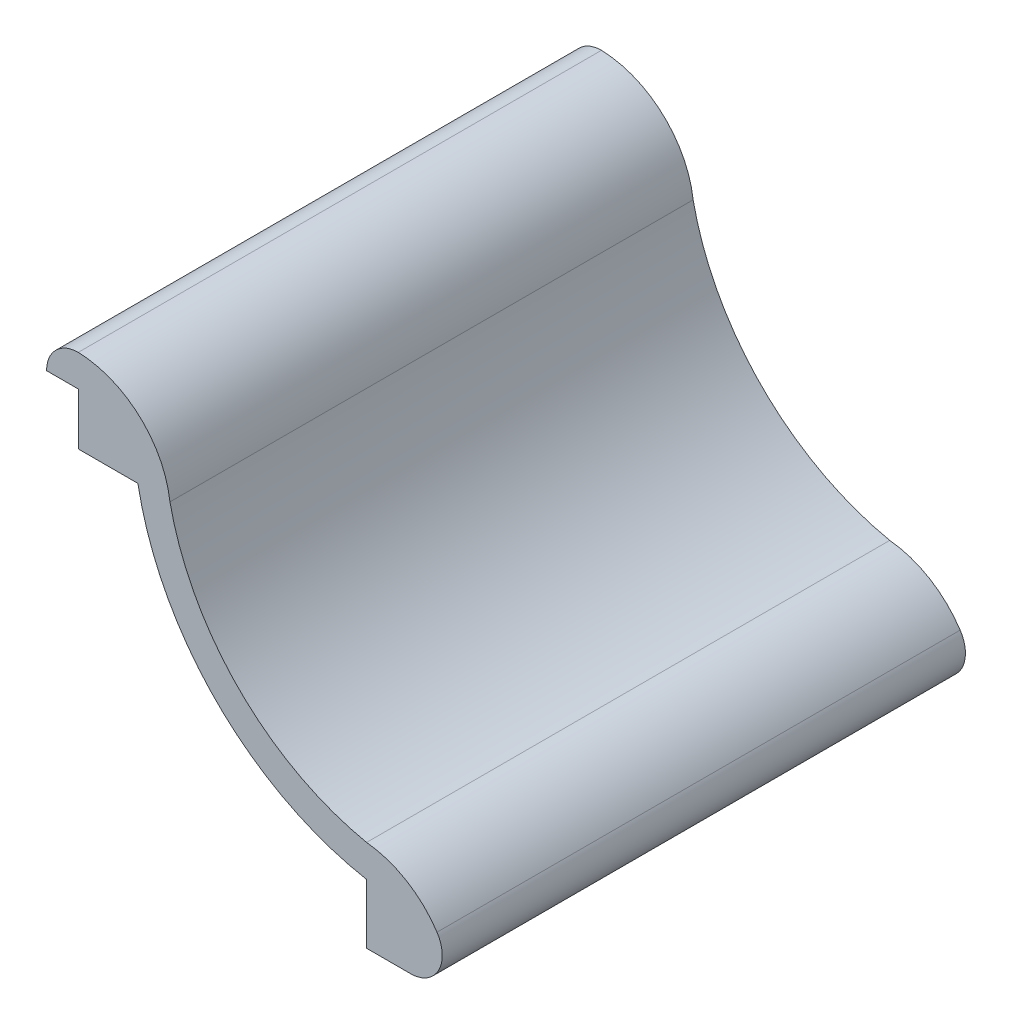
from build123d import *

# Parameters (mm, degrees)
BOSS_EXTRUDE1_DEPTH = 104.775
BOSS_EXTRUDE2_DEPTH = 92.5957
BOSS_EXTRUDE3_START = -5.8293
BOSS_EXTRUDE3_DEPTH = 5.8293
BOSS_EXTRUDE4_DEPTH = 6.35
SKETCH5_W           = 7.787485422
SKETCH5_H           = 19.833751934
SKETCH5_W_2         = 22.754058967
SKETCH5_H_2         = 3.407024872
CUT_EXTRUDE1_DEPTH  = 227.312030137
SKETCH9_W           = 103.741840618
SKETCH9_H           = 106.576317138
CUT_EXTRUDE4_DEPTH  = 104.775
SKETCH10_W          = 104.775
SKETCH10_H          = 6.354337814
BOSS_EXTRUDE6_DEPTH = 6.35
FILLET2_R           = 6.35


with BuildPart() as part:
    # Sketch1 → Boss-Extrude1 (new, symmetric)
    with BuildSketch(Plane.XY):
        with BuildLine():
            Line((-58.2422, 56.2102), (-58.2422, 62.5602))
            ThreePointArc((-58.2422, 62.5602), (-45.640852469, 57.743322347), (-39.3748699, 45.7962))
            ThreePointArc((-39.3748699, 45.7962), (-25.556268964, 20.239931036), (0, 6.4213301))
            ThreePointArc((0, 6.4213301), (12.247457496, 0.293755183), (17.272, -12.446))
            Line((17.272, -12.446), (10.922, -12.446))
            ThreePointArc((10.922, -12.446), (7.760938146, -4.204686933), (0, 0))
            ThreePointArc((0, 0), (-30.011530905, 15.784669095), (-45.7962, 45.7962))
            ThreePointArc((-45.7962, 45.7962), (-50.144819563, 53.243313205), (-58.2422, 56.2102))
        make_face()
    extrude(amount=BOSS_EXTRUDE1_DEPTH, both=True)


with BuildPart() as boss_extrude2_tool:
    # Sketch2 → Boss-Extrude2 (new, symmetric)
    with BuildSketch(Plane.XY):
        with BuildLine():
            Line((-58.2422, 56.2102), (-58.2422, 45.796198296))
            Line((-58.2422, 45.796198296), (-45.796199685, 45.796198296))
            ThreePointArc((-45.796199685, 45.796198296), (-50.144818899, 53.243312648), (-58.2422, 56.2102))
        make_face()
        with BuildLine():
            Line((0, 0), (0, -12.446))
            Line((0, -12.446), (10.922, -12.446))
            ThreePointArc((10.922, -12.446), (7.760938146, -4.204686933), (0, 0))
        make_face()
    extrude(amount=BOSS_EXTRUDE2_DEPTH, both=True)


with BuildPart() as part_1:
    add(part.part)


with BuildPart() as part_2:
    # Boss-Extrude2: joined with boss_extrude2_tool
    add(part_1.part.fuse(boss_extrude2_tool.part, tol=0.00001))

    # Sketch3 → Boss-Extrude3 (add)
    with BuildSketch(Plane(origin=(0, 0, -104.775), x_dir=(-1, 0, 0), z_dir=(0, 0, -1)).offset(BOSS_EXTRUDE3_START)):
        with BuildLine():
            Line((58.2422, 56.2102), (58.2422, 45.796198296))
            Line((58.2422, 45.796198296), (45.7962, 45.7962))
            ThreePointArc((45.7962, 45.7962), (50.144819563, 53.243313205), (58.2422, 56.2102))
        make_face()
        with BuildLine():
            Line((0, 0), (0, -12.446))
            Line((0, -12.446), (-10.922, -12.446))
            ThreePointArc((-10.922, -12.446), (-7.760938146, -4.204686933), (0, 0))
        make_face()
    extrude(amount=BOSS_EXTRUDE3_DEPTH)

    # Sketch4 → Boss-Extrude4 (add)
    with BuildSketch(Plane.XY.offset(104.775)):
        with BuildLine():
            Line((-58.2422, 56.2102), (-58.2422, 45.796198296))
            Line((-58.2422, 45.796198296), (-45.7962, 45.7962))
            ThreePointArc((-45.7962, 45.7962), (-50.144819563, 53.243313205), (-58.2422, 56.2102))
        make_face()
        with BuildLine():
            Line((0, 0), (0, -12.446))
            Line((0, -12.446), (10.922, -12.446))
            ThreePointArc((10.922, -12.446), (7.760938146, -4.204686933), (0, 0))
        make_face()
    extrude(amount=-BOSS_EXTRUDE4_DEPTH)

    # Sketch5 → Cut-Extrude1 (cut, through all)
    with BuildSketch(Plane.XY.offset(104.775)):
        with Locations((-61.627942711, 54.680509116)):
            Rectangle(SKETCH5_W, SKETCH5_H)
        with Locations((8.225058429, -13.641512436)):
            Rectangle(SKETCH5_W_2, SKETCH5_H_2)
    extrude(amount=-CUT_EXTRUDE1_DEPTH, mode=Mode.SUBTRACT)

    # Sketch9 → Cut-Extrude4 (cut)
    with BuildSketch(Plane(origin=(0, 0, -104.775), x_dir=(-1, 0, 0), z_dir=(0, 0, -1))):
        with Locations((16.552204841, 26.535028587)):
            Rectangle(SKETCH9_W, SKETCH9_H)
    extrude(amount=-CUT_EXTRUDE4_DEPTH, mode=Mode.SUBTRACT)

    # Sketch10 → Boss-Extrude6 (add)
    with BuildSketch(Plane.ZY.offset(57.7342)):
        with Locations((52.3875, 59.374341949)):
            Rectangle(SKETCH10_W, SKETCH10_H)
    extrude(amount=BOSS_EXTRUDE6_DEPTH)

    # Fillet2
    # the kernel refuses this fillet: 6.35 mm, written as the material it takes off along each edge
    with BuildSketch(Plane(origin=(17.260151367, -11.938, -25.849178653), x_dir=(-0.30497213299383213, 0.9523612749882223, 0), z_dir=(0, 0, 1))) as fillet2_piece_1:
        with BuildLine():
            CenterArc((8.625598356, 6.114282737), FILLET2_R, 162.243512631, 123.416753829)
            Line((2.57810426, 8.050855782), (0, 0))
            ThreePointArc((0, 0), (5.169835731, -0.710949564), (10.339671461, 0))
        make_face()
    extrude(amount=156.473357306, mode=Mode.SUBTRACT)
    with BuildSketch(Plane(origin=(-64.0842, 62.551510856, -15.875), x_dir=(1, 0, 0), z_dir=(0, 0, 1))) as fillet2_piece_2:
        with BuildLine():
            CenterArc((FILLET2_R, -FILLET2_R), FILLET2_R, 90, 90)
            Line((0, -FILLET2_R), (0, 0))
            Line((0, 0), (FILLET2_R, 0))
        make_face()
    extrude(amount=136.525, mode=Mode.SUBTRACT)


solid = part_2.part
